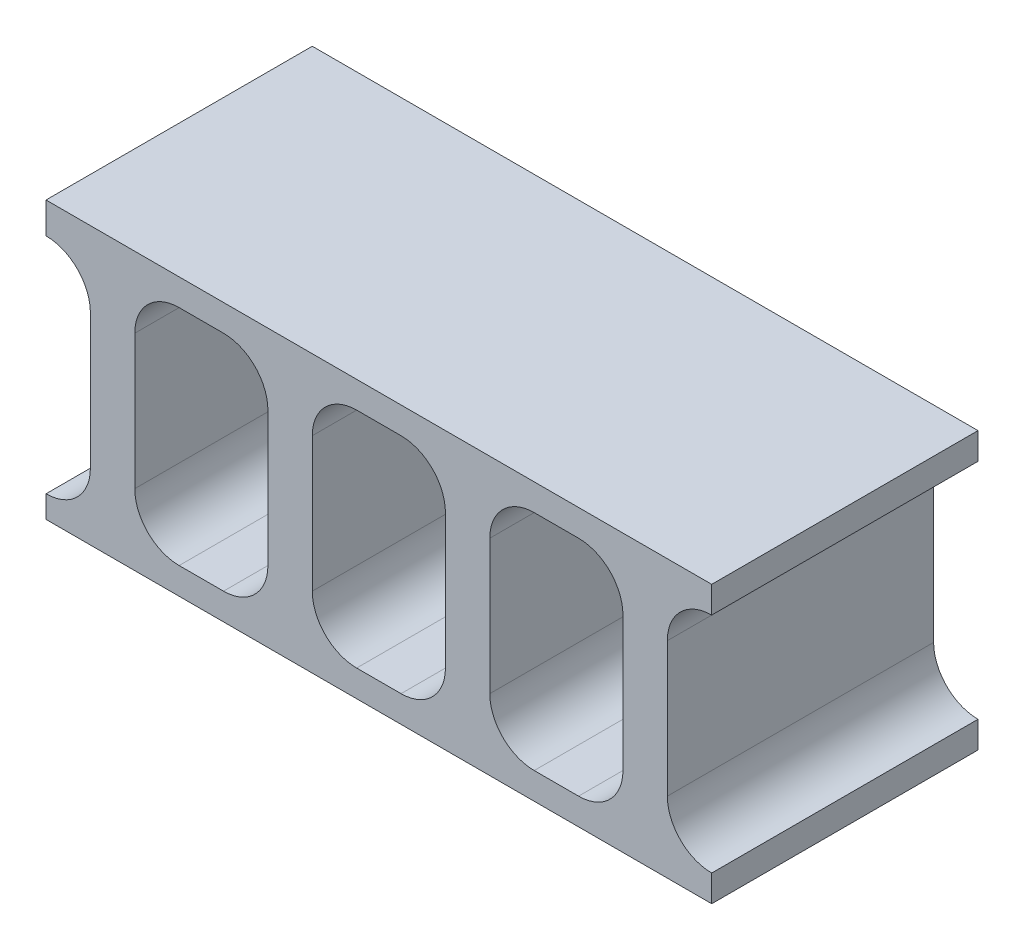
from build123d import *

# Parameters (mm, degrees)
SKETCH_1_W      = 15
SKETCH_1_H      = 25.166666667
EXTRUDE_1_DEPTH = 30
FILLET_1_R      = 5
FILLET_2_R      = 5
FILLET_3_R      = 5


with BuildPart() as part:
    # 草圖1 → 填料-伸長1 (new body)
    with BuildSketch(Plane.XY):
        Polygon((-23.5, 11.416666667), (51.5, 11.416666667), (51.5, 8.416666667), (46.5, 8.416666667), (46.5, -16.75), (51.5, -16.75), (51.5, -19.75), (-23.5, -19.75), (-23.5, -17.25), (-18.5, -17.25), (-18.5, 7.916666667), (-23.5, 7.916666667), align=None)
        with Locations((-6, -4.166666666)):
            Rectangle(SKETCH_1_W, SKETCH_1_H, mode=Mode.SUBTRACT)
        with Locations((14, -4.166666666)):
            Rectangle(SKETCH_1_W, SKETCH_1_H, mode=Mode.SUBTRACT)
        with Locations((34, -4.166666666)):
            Rectangle(SKETCH_1_W, SKETCH_1_H, mode=Mode.SUBTRACT)
    extrude(amount=EXTRUDE_1_DEPTH)

    # 圓角1
    fillet_1_edges = [part.edges().sort_by_distance(p)[0] for p in [
        (-18.5, 7.916666667, 15),
    ]]
    fillet(fillet_1_edges, radius=FILLET_1_R - 0.0001)  # a hair under: the kernel refuses the full size

    # 圓角2
    fillet_2_edges = [part.edges().sort_by_distance(p)[0] for p in [
        (-18.5, -17.25, 15),
    ]]
    fillet(fillet_2_edges, radius=FILLET_2_R - 0.0001)  # a hair under: the kernel refuses the full size

    # 圓角3
    fillet_3_edges = [part.edges().sort_by_distance(p)[0] for p in [
        (46.5, 8.416666667, 15),
        (46.5, -16.75, 15),
        (-13.5, 8.416666667, 15),
        (-13.5, -16.75, 15),
        (1.5, -16.75, 15),
        (1.5, 8.416666667, 15),
        (6.5, 8.416666667, 15),
        (6.5, -16.75, 15),
        (21.5, -16.75, 15),
        (21.5, 8.416666667, 15),
        (26.5, 8.416666667, 15),
        (26.5, -16.75, 15),
        (41.5, -16.75, 15),
        (41.5, 8.416666667, 15),
    ]]
    fillet(fillet_3_edges, radius=FILLET_3_R - 0.0001)  # a hair under: the kernel refuses the full size


solid = part.part
